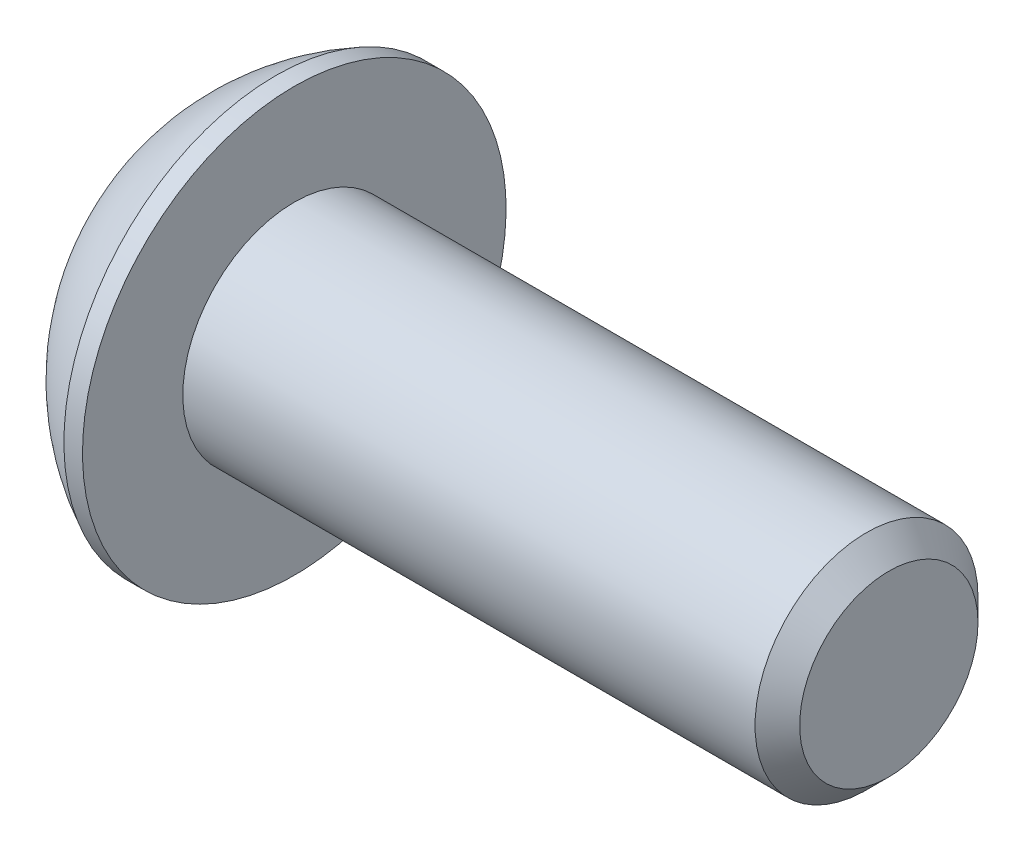
from build123d import *

# Parameters (mm, degrees)
SKETCH2_R           = 1.5
BOSS_EXTRUDE1_DEPTH = 8
CHAMFER1_SIZE       = 0.3
CUT_EXTRUDE1_DEPTH  = 1.2
SKETCH8_R           = 1.204700538
CUT_EXTRUDE2_DEPTH  = 1
CUT_EXTRUDE2_DRAFT  = -45


with BuildPart() as part:
    # Sketch2 → Boss-Extrude1 (new body)
    with BuildSketch(Plane(origin=(0, 0, 0), x_dir=(0, 0, -1), z_dir=(1, 0, 0))):
        Circle(SKETCH2_R)
    extrude(amount=-BOSS_EXTRUDE1_DEPTH)

    # Chamfer1
    chamfer1_edges = [part.edges().sort_by_distance(p)[0] for p in [
        (0, 0, 1.5),
    ]]
    chamfer(chamfer1_edges, length=CHAMFER1_SIZE)

    # Sketch6 → Revolve1 (revolve)
    with BuildSketch(Plane.XY):
        with BuildLine():
            Line((-9.65, 0), (-9.65, 1.5))
            ThreePointArc((-9.65, 1.5), (-9.055944823, 2.284868705), (-8.25, 2.85))
            Line((-8.25, 2.85), (-8, 2.85))
            Line((-8, 2.85), (-8, 0))
            Line((-8, 0), (-9.65, 0))
        make_face()
    revolve(axis=Axis((-8, 0, 0), (-1, 0, 0)))

    # Sketch7 → Cut-Extrude1 (cut)
    with BuildSketch(Plane.ZY.offset(9.65)):
        Polygon((0, 1.154700538), (-1, 0.577350269), (-1, -0.577350269), (0, -1.154700538), (1, -0.577350269), (1, 0.577350269), align=None)
    extrude(amount=-CUT_EXTRUDE1_DEPTH, mode=Mode.SUBTRACT)


with BuildPart() as cut_extrude2_tool:
    # Sketch8 → Cut-Extrude2 (with draft: the straight prism first)
    with BuildSketch(Plane.ZY.offset(9.65)):
        Circle(SKETCH8_R)
    extrude(amount=-CUT_EXTRUDE2_DEPTH)
    # Cut-Extrude2: the draft: its side faces are tilted about the plane it starts from
    cut_extrude2_sides = [cut_extrude2_tool.faces().sort_by_distance(p)[0] for p in [
        (-9.15, 0, -1.204700538),
    ]]
    draft(cut_extrude2_sides, Plane.ZY.offset(9.65), CUT_EXTRUDE2_DRAFT)


with BuildPart() as part_1:
    add(part.part)

    # Cut-Extrude2: cut by cut_extrude2_tool
    add(cut_extrude2_tool.part, mode=Mode.SUBTRACT)


solid = part_1.part
